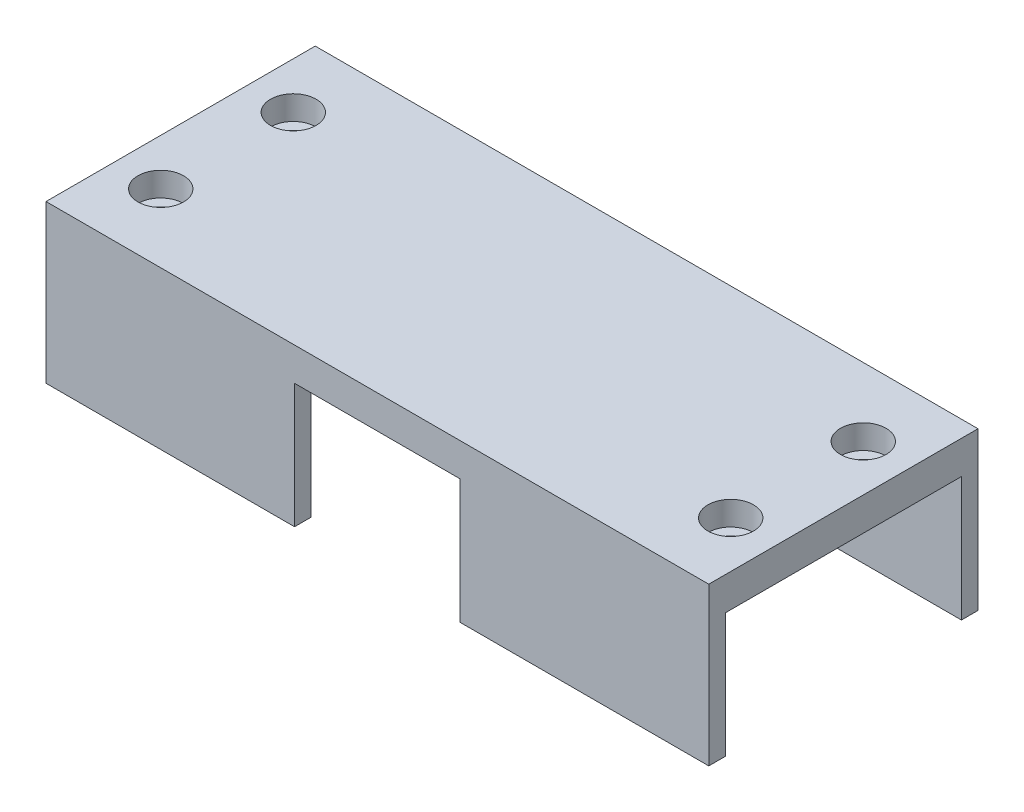
from build123d import *

# Parameters (mm, degrees)
SKETCH1_W                                            = 80
SKETCH1_H                                            = 32.5
BOSS_EXTRUDE1_DEPTH                                  = 4
CBORE_FOR_M2_5_HEX_SOCKET_HEAD_CAP_SCREW_D           = 2.9
CBORE_FOR_M2_5_HEX_SOCKET_HEAD_CAP_SCREW_CBORE_D     = 5.5
CBORE_FOR_M2_5_HEX_SOCKET_HEAD_CAP_SCREW_CBORE_DEPTH = 2.9
SKETCH5_W                                            = 30
SKETCH5_H                                            = 2
BOSS_EXTRUDE2_DEPTH                                  = 15


with BuildPart() as part:
    # Sketch1 → Boss-Extrude1 (new body)
    with BuildSketch(Plane(origin=(0, 0, 0), x_dir=(1, 0, 0), z_dir=(0, 1, 0))):
        with Locations((40, 16.25)):
            Rectangle(SKETCH1_W, SKETCH1_H)
    extrude(amount=BOSS_EXTRUDE1_DEPTH)

    # CBORE for M2.5 Hex Socket Head Cap Screw1 (through all)
    with Locations(Plane(origin=(0, 4, 0), x_dir=(1, 0, 0), z_dir=(0, 1, 0))):
        with Locations((-6.4, 24.25), (5.6, 24.25), (5.6, 8.25), (-6.4, 8.25), (86.4, 8.25), (74.4, 8.25), (74.4, 24.25), (86.4, 24.25)):
            CounterBoreHole(CBORE_FOR_M2_5_HEX_SOCKET_HEAD_CAP_SCREW_D / 2, CBORE_FOR_M2_5_HEX_SOCKET_HEAD_CAP_SCREW_CBORE_D / 2, CBORE_FOR_M2_5_HEX_SOCKET_HEAD_CAP_SCREW_CBORE_DEPTH)

    # Sketch5 → Boss-Extrude2 (add)
    with BuildSketch(Plane.XZ):
        with Locations((15, -1)):
            Rectangle(SKETCH5_W, SKETCH5_H)
        with Locations((65, -1)):
            Rectangle(SKETCH5_W, SKETCH5_H)
        with Locations((15, -31.5)):
            Rectangle(SKETCH5_W, SKETCH5_H)
        with Locations((65, -31.5)):
            Rectangle(SKETCH5_W, SKETCH5_H)
    extrude(amount=BOSS_EXTRUDE2_DEPTH)


solid = part.part
